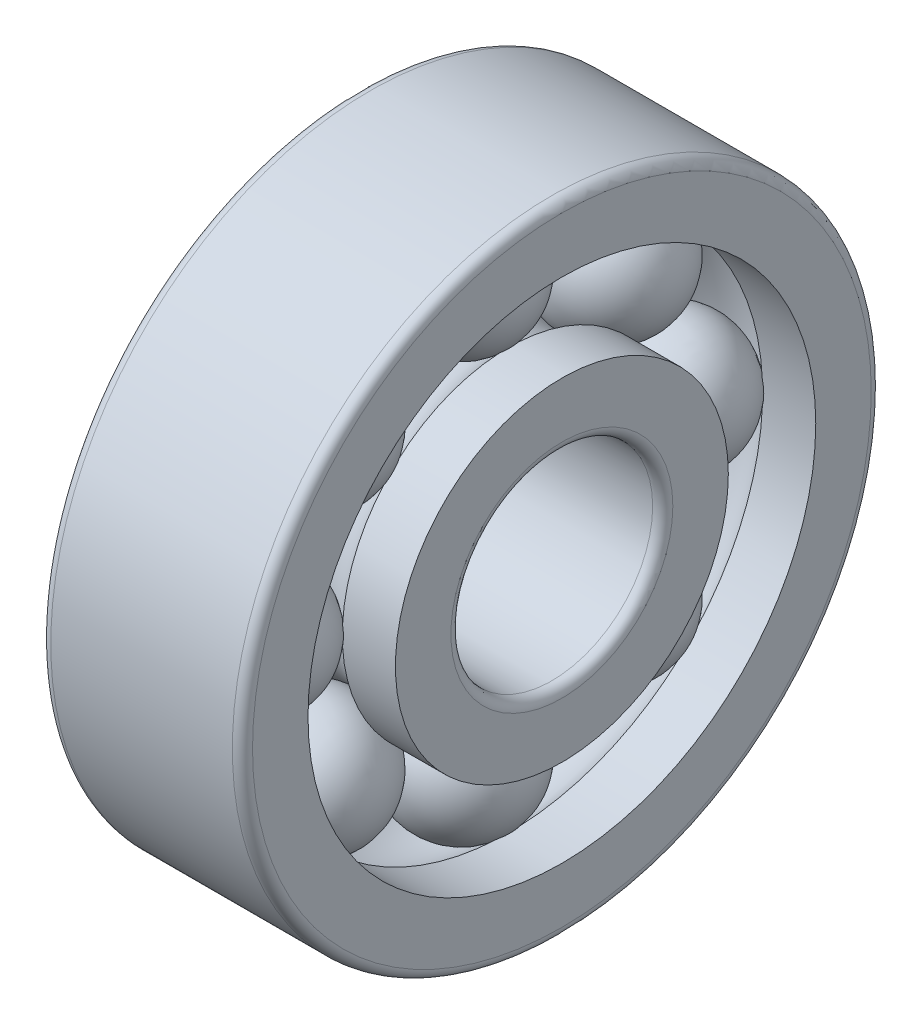
from build123d import *

# Parameters (mm, degrees)
CAGSPISKE_W         = 0.39
CAGSPISKE_H         = 0.65
CAGESPINE_ANGLE     = 0.001
BALLSDETAILED_COUNT = 8
BALLSDETAILED_ANGLE = 315


with BuildPart() as part:
    # CagSpiSke → CageSpine (revolve)
    with BuildSketch(Plane.XY):
        with Locations((0, 6.25)):
            Rectangle(CAGSPISKE_W, CAGSPISKE_H)
    revolve(axis=Axis((-20.6375, 0, 0), (-1, 0, 0)), revolution_arc=CAGESPINE_ANGLE)

    # BalDetSke → BallDetailed (revolve)
    with BuildSketch(Plane.XY):
        with BuildLine():
            Line((-1.95, 6.25), (1.95, 6.25))
            ThreePointArc((1.95, 6.25), (0, 4.3), (-1.95, 6.25))
        make_face()
    balldetailed = revolve(axis=Axis((-1.905, 6.25, 0), (1, 0, 0)))

    # InnRacSke → InnerRace (revolve)
    with BuildSketch(Plane.XY):
        with BuildLine():
            Line((-1.419727086, 4.95), (-3, 4.95))
            Line((-3, 4.95), (-3, 3.3))
            ThreePointArc((-3, 3.3), (-2.912132034, 3.087867966), (-2.7, 3))
            Line((-2.7, 3), (2.7, 3))
            ThreePointArc((2.7, 3), (2.912132034, 3.087867966), (3, 3.3))
            Line((3, 3.3), (3, 4.95))
            Line((3, 4.95), (1.419727086, 4.95))
            ThreePointArc((1.419727086, 4.95), (0, 4.325), (-1.419727086, 4.95))
        make_face()
    revolve(axis=Axis((-20.6375, 0, 0), (1, 0, 0)))

    # OutRacSke → OuterRace (revolve)
    with BuildSketch(Plane.XY):
        with BuildLine():
            Line((-1.419727086, 7.55), (-3, 7.55))
            Line((-3, 7.55), (-3, 9.2))
            ThreePointArc((-3, 9.2), (-2.912132034, 9.412132034), (-2.7, 9.5))
            Line((-2.7, 9.5), (2.7, 9.5))
            ThreePointArc((2.7, 9.5), (2.912132034, 9.412132034), (3, 9.2))
            Line((3, 9.2), (3, 7.55))
            Line((3, 7.55), (1.419727086, 7.55))
            ThreePointArc((1.419727086, 7.55), (0, 8.175), (-1.419727086, 7.55))
        make_face()
    revolve(axis=Axis((-20.6375, 0, 0), (1, 0, 0)))

    # BallsDetailed: BallDetailed ×8 about axis
    ballsdetailed_axis = Axis((-50, 0, 0), (1, 0, 0))
    for i in range(1, BALLSDETAILED_COUNT):
        add(balldetailed.rotate(ballsdetailed_axis, i * BALLSDETAILED_ANGLE / (BALLSDETAILED_COUNT - 1)))


solid = part.part
